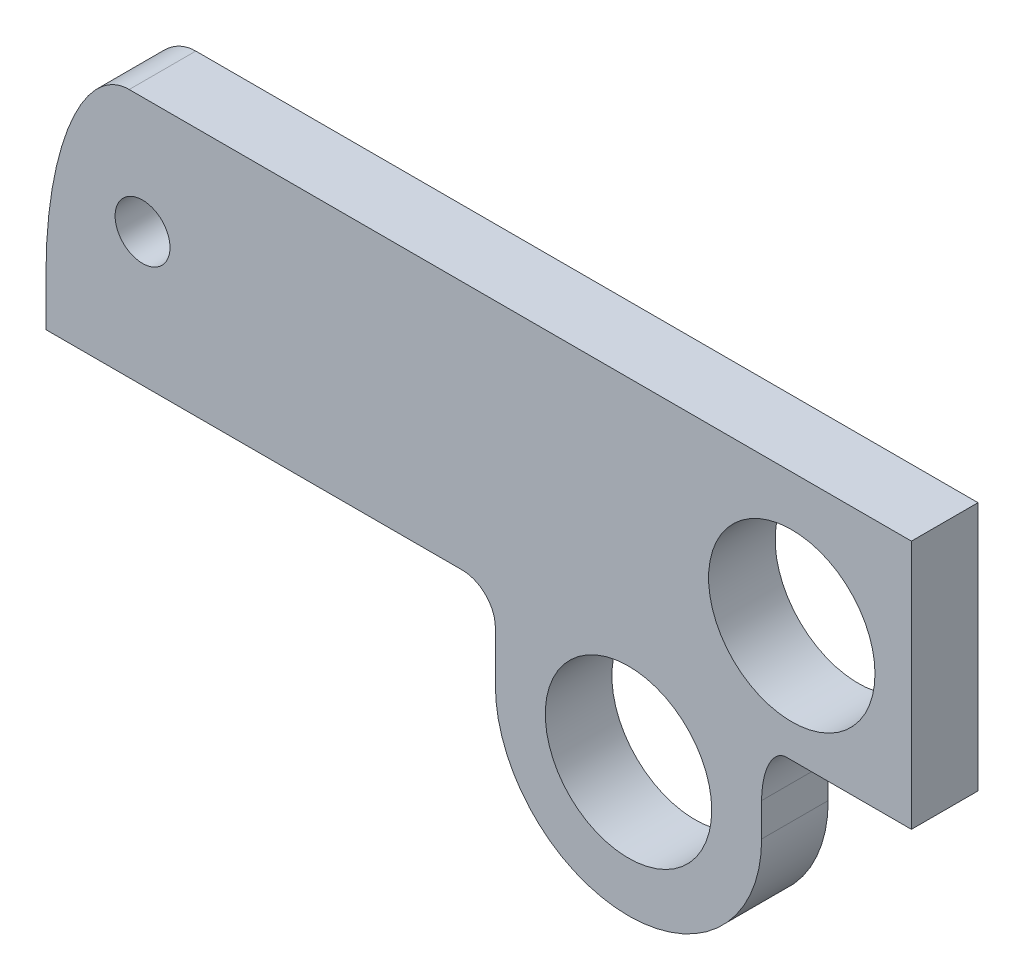
from build123d import *

# Parameters (mm, degrees)
RESSALTO_EXTRUS_O1_DEPTH = 4
FILETE3_R                = 8
ESBO_O2_R                = 1.65
ESBO_O2_R_2              = 5
CORTE_EXTRUS_O1_DEPTH    = 40.102429592
FILETE12_SIZE            = 5
FILETE12_SIZE_2          = 12
FILETE14_R               = 2
ESBO_O3_W                = 9
ESBO_O3_H                = 13
CORTE_EXTRUS_O2_DEPTH    = 40.102429743
FILETE15_R               = 8
FILETE16_SIZE            = 3
FILETE16_SIZE_2          = 1.5


# Some blends are built 0.0001 mm under size
with BuildPart() as part:
    # Esboço1 → Ressalto-extrusão1 (new body)
    with BuildSketch(Plane.XY):
        Polygon((0, 0), (25, 0), (25, 28), (-27, 28), (-27, 13), (0, 13), align=None)
    extrude(amount=RESSALTO_EXTRUS_O1_DEPTH)

    # Filete3
    filete3_edges = [part.edges().sort_by_distance(p)[0] for p in [
        (0, 0, 2),
    ]]
    fillet(filete3_edges, radius=FILETE3_R)

    # Esboço2 → Corte-extrusão1 (cut, through all)
    with BuildSketch(Plane.XY.offset(4)):
        with Locations((-21.2, 21)):
            Circle(ESBO_O2_R)
        with Locations((8, 8)):
            Circle(ESBO_O2_R_2)
        with Locations((17.810708435, 20)):
            Circle(ESBO_O2_R_2)
    extrude(amount=-CORTE_EXTRUS_O1_DEPTH, mode=Mode.SUBTRACT)

    # Filete12
    # an asymmetric fillet: 12, 5 mm, written as the material it takes off along each edge
    with BuildSketch(Plane(origin=(-27, 28, -30), x_dir=(1, 0, 0), z_dir=(0, 0, 1))) as filete12_piece_1:
        with BuildLine():
            Bezier((FILETE12_SIZE, 0), (0, 0), (0, -FILETE12_SIZE_2), weights=[1, 0.707106781, 1])
            Line((0, -FILETE12_SIZE_2), (0, 0))
            Line((0, 0), (FILETE12_SIZE, 0))
        make_face()
    extrude(amount=64, mode=Mode.SUBTRACT)

    # Filete14
    filete14_edges = [part.edges().sort_by_distance(p)[0] for p in [
        (0, 13, 2),
    ]]
    fillet(filete14_edges, radius=FILETE14_R)

    # Esboço3 → Corte-extrusão2 (cut, through all)
    with BuildSketch(Plane.XY.offset(4)):
        with Locations((20.5, 6.5)):
            Rectangle(ESBO_O3_W, ESBO_O3_H)
    extrude(amount=-CORTE_EXTRUS_O2_DEPTH, mode=Mode.SUBTRACT)

    # Filete15
    filete15_edges = [part.edges().sort_by_distance(p)[0] for p in [
        (16, 0, 2),
    ]]
    fillet(filete15_edges, radius=FILETE15_R - 0.0001)  # a hair under: the kernel refuses the full size

    # Filete16
    # an asymmetric fillet: 3, 1.5 mm, written as the material it adds along each edge
    with BuildSketch(Plane(origin=(16, 13, 4), x_dir=(0, -1, 0), z_dir=(0, 0, -1))) as filete16_piece_1:
        with BuildLine():
            Bezier((FILETE16_SIZE, 0), (0, 0), (0, -FILETE16_SIZE_2), weights=[1, 0.707106781, 1])
            Line((0, -FILETE16_SIZE_2), (0, 0))
            Line((0, 0), (FILETE16_SIZE, 0))
        make_face()
    extrude(amount=4)


solid = part.part
